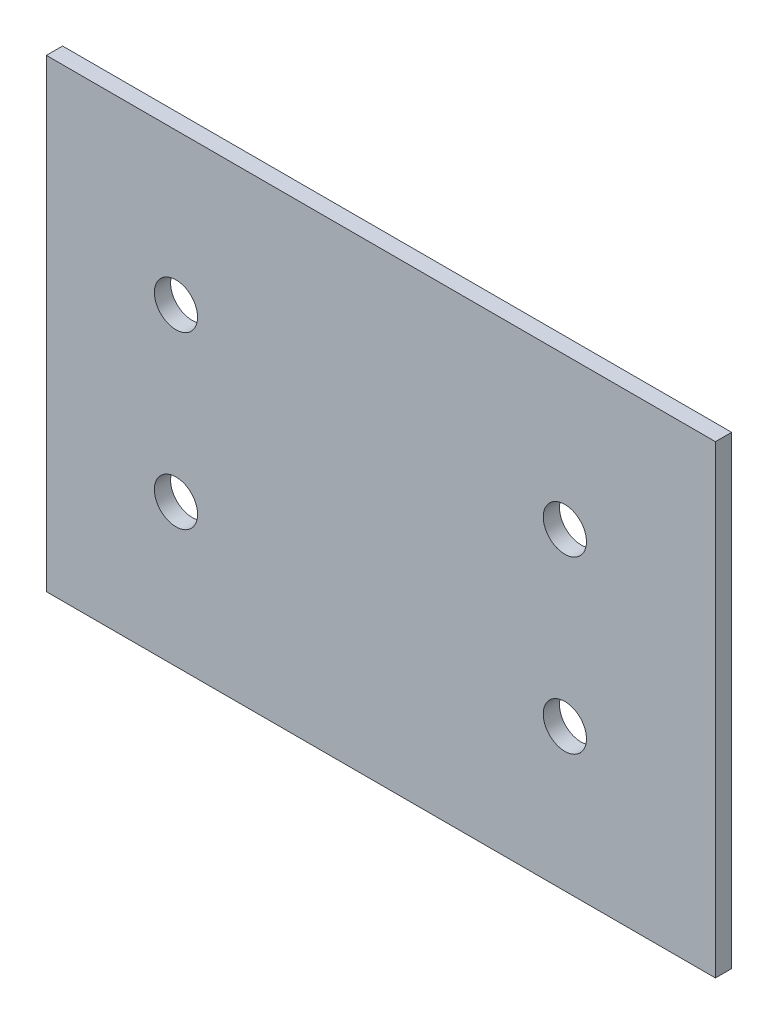
from build123d import *

# Parameters (mm, degrees)
SKETCH1_W           = 78.6638
SKETCH1_H           = 54.61
BOSS_EXTRUDE1_DEPTH = 1.905
SKETCH2_R           = 2.54
CUT_EXTRUDE1_DEPTH  = 48.918581027


with BuildPart() as part:
    # Sketch1 → Boss-Extrude1 (new body)
    with BuildSketch(Plane.XY):
        Rectangle(SKETCH1_W, SKETCH1_H)
    extrude(amount=BOSS_EXTRUDE1_DEPTH)

    # Sketch2 → Cut-Extrude1 (cut, through all)
    with BuildSketch(Plane.XY.offset(1.905)):
        with Locations((-24.0919, 9.525)):
            Circle(SKETCH2_R)
        with Locations((-24.0919, -10.541)):
            Circle(SKETCH2_R)
        with Locations((21.6281, 9.525)):
            Circle(SKETCH2_R)
        with Locations((21.6281, -10.541)):
            Circle(SKETCH2_R)
    extrude(amount=-CUT_EXTRUDE1_DEPTH, mode=Mode.SUBTRACT)


solid = part.part
